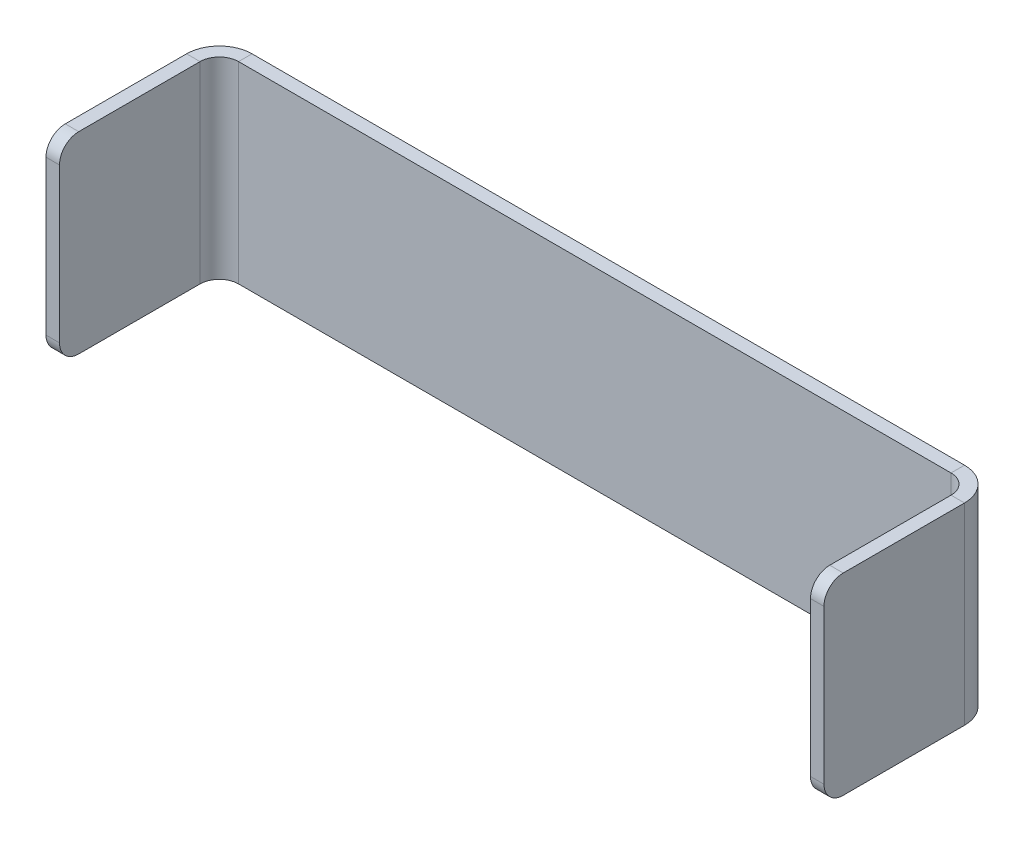
from build123d import *

# Parameters (mm, degrees)
SKETCH2_W                    = 39
SKETCH2_H                    = 10
BASE_FLANGE1_DEPTH           = 0.7
EDGE_FLANGE1_STRIP_W         = 4.8
EDGE_FLANGE1_STRIP_H         = 0.7
EDGE_FLANGE1_STRIP_CUT_DEPTH = 10
EDGE_FLANGE1_DEPTH           = 10
EDGE_FLANGE2_STRIP_W         = 4.8
EDGE_FLANGE2_STRIP_H         = 0.7
EDGE_FLANGE2_STRIP_CUT_DEPTH = 10
EDGE_FLANGE2_DEPTH           = 10
FILLET1_R                    = 1


# Sheet-metal steps are written as plain solids
with BuildPart() as part:
    # Sketch2 → Base-Flange1 (new body)
    with BuildSketch(Plane.XY):
        Rectangle(SKETCH2_W, SKETCH2_H)
    extrude(amount=-BASE_FLANGE1_DEPTH)

    # Edge-Flange1 strip (across the edge) → Edge-Flange1 strip cut (cut)
    with BuildSketch(Plane(origin=(-19.5, 5, 0), x_dir=(1, 0, 0), z_dir=(0, -1, 0))):
        with Locations((-1.4, -0.35)):
            Rectangle(EDGE_FLANGE1_STRIP_W, EDGE_FLANGE1_STRIP_H)
    extrude(amount=EDGE_FLANGE1_STRIP_CUT_DEPTH, mode=Mode.SUBTRACT)

    # Edge-Flange1 section (across the edge) → Edge-Flange1 (add)
    with BuildSketch(Plane(origin=(-19.5, 5, 0), x_dir=(1, 0, 0), z_dir=(0, -1, 0))):
        with BuildLine():
            Line((-0.7, 1), (-0.7, 8.3))
            Line((-0.7, 8.3), (0, 8.3))
            Line((0, 8.3), (0, 1))
            ThreePointArc((0, 1), (0.292893219, 0.292893219), (1, 0))
            Line((1, 0), (1, -0.7))
            ThreePointArc((1, -0.7), (-0.202081528, -0.202081528), (-0.7, 1))
        make_face()
    extrude(amount=EDGE_FLANGE1_DEPTH)

    # Edge-Flange2 strip (across the edge) → Edge-Flange2 strip cut (cut)
    with BuildSketch(Plane(origin=(19.5, -5, 0), x_dir=(-1, 0, 0), z_dir=(0, 1, 0))):
        with Locations((-1.4, -0.35)):
            Rectangle(EDGE_FLANGE2_STRIP_W, EDGE_FLANGE2_STRIP_H)
    extrude(amount=EDGE_FLANGE2_STRIP_CUT_DEPTH, mode=Mode.SUBTRACT)

    # Edge-Flange2 section (across the edge) → Edge-Flange2 (add)
    with BuildSketch(Plane(origin=(19.5, -5, 0), x_dir=(-1, 0, 0), z_dir=(0, 1, 0))):
        with BuildLine():
            Line((-0.7, 1), (-0.7, 8.3))
            Line((-0.7, 8.3), (0, 8.3))
            Line((0, 8.3), (0, 1))
            ThreePointArc((0, 1), (0.292893219, 0.292893219), (1, 0))
            Line((1, 0), (1, -0.7))
            ThreePointArc((1, -0.7), (-0.202081528, -0.202081528), (-0.7, 1))
        make_face()
    extrude(amount=EDGE_FLANGE2_DEPTH)

    # Fillet1
    fillet1_edges = [part.edges().sort_by_distance(p)[0] for p in [
        (-19.85, 5, 8.3),
        (-19.85, -5, 8.3),
        (19.85, -5, 8.3),
        (19.85, 5, 8.3),
    ]]
    fillet(fillet1_edges, radius=FILLET1_R)


solid = part.part
